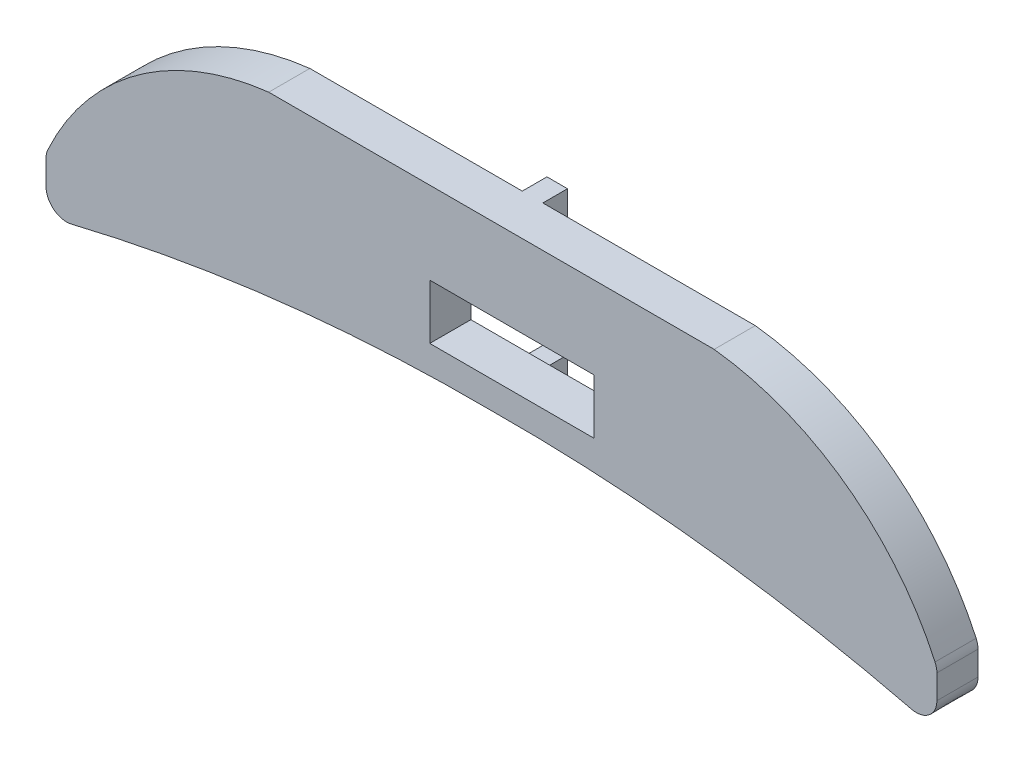
from build123d import *

# Parameters (mm, degrees)
BOSS_EXTRUDE1_DEPTH     = 3
CUT_EXTRUDE1_DEPTH      = 67.166456759
CUT_EXTRUDE1_DEPTH_BACK = 67.166456759
SKETCH2_W               = 12
SKETCH2_H               = 4
VARFILLET1_R            = 1.5
BOSS_EXTRUDE2_START     = 1.8
SKETCH3_W               = 1.49997773
SKETCH3_H               = 2
BOSS_EXTRUDE2_DEPTH     = 1.8


with BuildPart() as part:
    # Sketch1 → Boss-Extrude1 (new body)
    with BuildSketch(Plane.XY):
        with BuildLine():
            Line((0, -4), (0, 0))
            ThreePointArc((0, 0), (-6.517304845, 8.177087189), (-16.25, 12))
            Line((-16.25, 12), (-48.75, 12))
            ThreePointArc((-48.75, 12), (-58.482695155, 8.177087189), (-65, 0))
            Line((-65, 0), (-65, -4))
            ThreePointArc((-65, -4), (-48.881086926, -0.934918729), (-32.5, 0))
            ThreePointArc((-32.5, 0), (-16.118913074, -0.934918729), (0, -4))
        make_face()
    extrude(amount=BOSS_EXTRUDE1_DEPTH)

    # Sketch2 → Cut-Extrude1 (cut, two sides: drawn at the far end of the back side and taken through both)
    with BuildSketch(Plane.XY.offset(3).offset(-CUT_EXTRUDE1_DEPTH_BACK)):
        with Locations((-31, 4)):
            Rectangle(SKETCH2_W, SKETCH2_H)
    extrude(amount=CUT_EXTRUDE1_DEPTH + CUT_EXTRUDE1_DEPTH_BACK, mode=Mode.SUBTRACT)

    # VarFillet1
    varfillet1_edges = [part.edges().sort_by_distance(p)[0] for p in [
        (-65, -4, 1.5),
        (-65, 0, 1.5),
        (0, -4, 1.5),
        (0, 0, 1.5),
    ]]
    fillet(varfillet1_edges, radius=VARFILLET1_R)

    # Sketch3 → Boss-Extrude2 (add)
    with BuildSketch(Plane(origin=(0, 0, 0), x_dir=(-1, 0, 0), z_dir=(0, 0, -1)).offset(BOSS_EXTRUDE2_START)):
        with BuildLine():
            Line((32.5, 0.004086765), (32.5, 0))
            ThreePointArc((32.5, 0), (32.874991378, 0.002603923), (33.249988865, 0.004086765))
            Line((33.249988865, 0.004086765), (33.249988865, 1.5))
            Line((33.249988865, 1.5), (31.750011135, 1.5))
            Line((31.750011135, 1.5), (31.750011135, 0.004086765))
            Line((31.750011135, 0.004086765), (32.5, 0.004086765))
        make_face()
        with Locations((32.5, 11)):
            Rectangle(SKETCH3_W, SKETCH3_H)
    extrude(amount=-BOSS_EXTRUDE2_DEPTH)


solid = part.part
